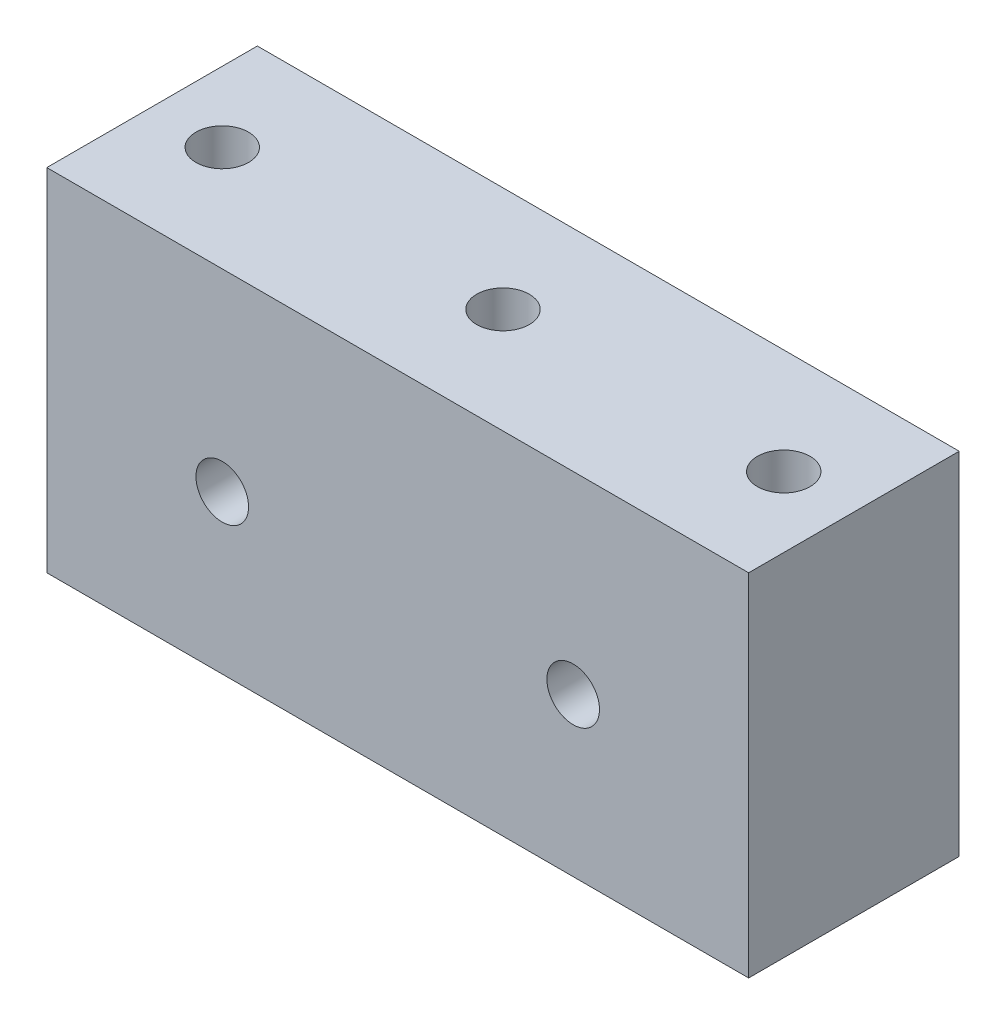
from build123d import *

# Parameters (mm, degrees)
SKETCH1_W           = 40
SKETCH1_H           = 12
SKETCH1_R           = 1.5
BOSS_EXTRUDE1_DEPTH = 20
SKETCH2_R           = 1.5
CUT_EXTRUDE1_DEPTH  = 20


with BuildPart() as part:
    # Sketch1 → Boss-Extrude1 (new body)
    with BuildSketch(Plane(origin=(0, 0, 0), x_dir=(1, 0, 0), z_dir=(0, 1, 0))):
        Rectangle(SKETCH1_W, SKETCH1_H)
        Circle(SKETCH1_R, mode=Mode.SUBTRACT)
        with Locations((-16, 0)):
            Circle(SKETCH1_R, mode=Mode.SUBTRACT)
        with Locations((16, 0)):
            Circle(SKETCH1_R, mode=Mode.SUBTRACT)
    extrude(amount=BOSS_EXTRUDE1_DEPTH)

    # Sketch2 → Cut-Extrude1 (cut)
    with BuildSketch(Plane(origin=(0, 0, -6), x_dir=(-1, 0, 0), z_dir=(0, 0, -1))):
        with Locations((10, 9)):
            Circle(SKETCH2_R)
        with Locations((-10, 9)):
            Circle(SKETCH2_R)
    extrude(amount=-CUT_EXTRUDE1_DEPTH, mode=Mode.SUBTRACT)


solid = part.part
